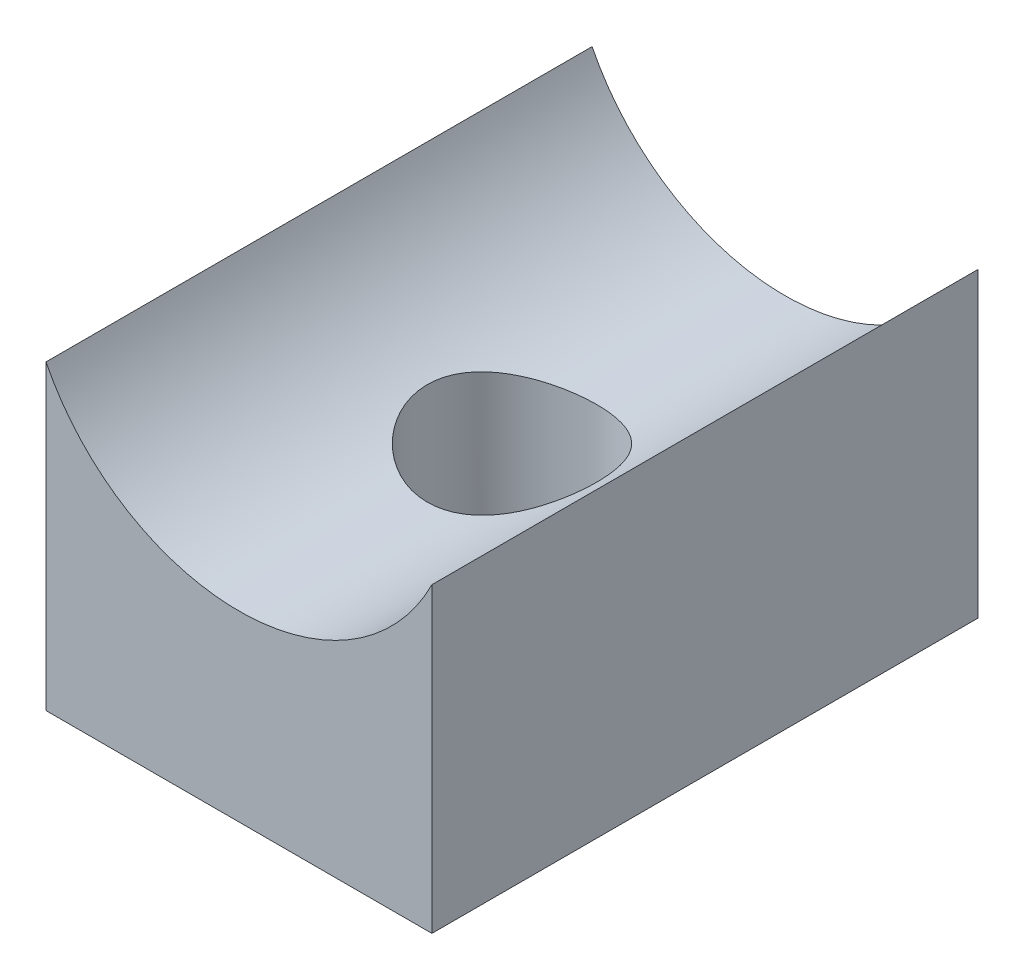
from build123d import *

# Parameters (mm, degrees)
BOSS_EXTRUDE1_DEPTH     = 5
CUT_EXTRUDE1_REACH      = 10.25
CUT_EXTRUDE1_END_RADIUS = 3.95
SKETCH2_R               = 1.55


with BuildPart() as part:
    # Sketch1 → Boss-Extrude1 (new, symmetric)
    with BuildSketch(Plane.XY):
        with BuildLine():
            Line((-3.533271058, -5.53), (3.533271058, -5.53))
            Line((3.533271058, -5.53), (3.533271058, 0))
            ThreePointArc((3.533271058, 0), (0, -2.184073719), (-3.533271058, 0))
            Line((-3.533271058, 0), (-3.533271058, -5.53))
        make_face()
    extrude(amount=BOSS_EXTRUDE1_DEPTH, both=True)

    # Cut-Extrude1: up to this cylinder (the profile starts outside it)
    cut_extrude1_end = Plane(origin=(0, 1.765926281, 0), z_dir=(0, 0, -1)) * Cylinder(CUT_EXTRUDE1_END_RADIUS, 29.4, mode=Mode.PRIVATE)
    # Sketch2 → Cut-Extrude1 (cut, up to the surface)
    with BuildSketch(Plane(origin=(0, -5.53, 0), x_dir=(-1, 0, 0), z_dir=(0, -1, 0)), mode=Mode.PRIVATE) as cut_extrude1_sk1:
        Circle(SKETCH2_R)
    cut_extrude1_tool1 = extrude(cut_extrude1_sk1.sketch, amount=-CUT_EXTRUDE1_REACH, mode=Mode.PRIVATE) - cut_extrude1_end
    add(cut_extrude1_tool1.solids().sort_by_distance((0, -5.53, 0))[0], mode=Mode.SUBTRACT)


solid = part.part
